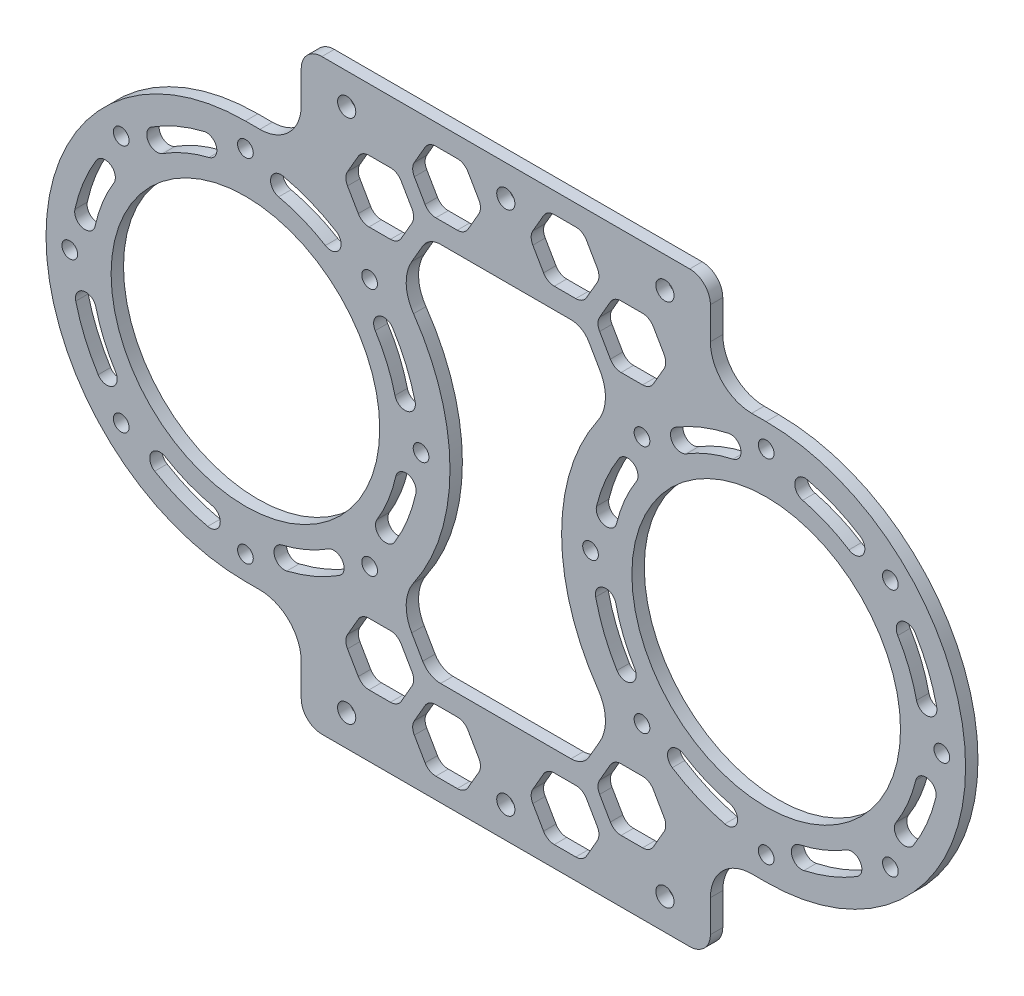
from build123d import *

# Parameters (mm, degrees)
SKETCH_1_R          = 32.5
SKETCH_1_R_2        = 1.9
EXTRUDE_1_DEPTH     = 3
SKETCH_2_W          = 99
SKETCH_2_H          = 27.75
EXTRUDE_2_DEPTH     = 3
SKETCH_3_R          = 2.2
CUT_EXTRUDE_1_DEPTH = 55
CUT_EXTRUDE_2_DEPTH = 43
SKETCH_7_W          = 99
SKETCH_7_H          = 5
CUT_EXTRUDE_3_DEPTH = 10
FILLET_1_R          = 5
FILLET_2_R          = 10
CUT_EXTRUDE_4_DEPTH = 10
EXTRUDE_3_DEPTH     = 3
CUT_EXTRUDE_5_DEPTH = 43
FILLET_3_R          = 5
FILLET_4_R          = 10


with BuildPart() as part:
    # 草图1 → 凸台-拉伸1 (new body)
    with BuildSketch(Plane.XY):
        with BuildLine():
            Line((0, 48.25), (126, 48.25))
            ThreePointArc((126, 48.25), (174.25, 0), (126, -48.25))
            Line((126, -48.25), (0, -48.25))
            ThreePointArc((0, -48.25), (-48.25, 0), (0, 48.25))
        make_face()
        with Locations((126, 0)):
            Circle(SKETCH_1_R, mode=Mode.SUBTRACT)
        Circle(SKETCH_1_R, mode=Mode.SUBTRACT)
        with Locations((0, 42.5)):
            Circle(SKETCH_1_R_2, mode=Mode.SUBTRACT)
        with Locations((30.0520382, 30.0520382)):
            Circle(SKETCH_1_R_2, mode=Mode.SUBTRACT)
        with Locations((42.5, 0)):
            Circle(SKETCH_1_R_2, mode=Mode.SUBTRACT)
        with Locations((30.0520382, -30.0520382)):
            Circle(SKETCH_1_R_2, mode=Mode.SUBTRACT)
        with Locations((0, -42.5)):
            Circle(SKETCH_1_R_2, mode=Mode.SUBTRACT)
        with Locations((-30.0520382, -30.0520382)):
            Circle(SKETCH_1_R_2, mode=Mode.SUBTRACT)
        with Locations((-42.5, 0)):
            Circle(SKETCH_1_R_2, mode=Mode.SUBTRACT)
        with Locations((-30.0520382, 30.0520382)):
            Circle(SKETCH_1_R_2, mode=Mode.SUBTRACT)
        with Locations((156.0520382, 30.0520382)):
            Circle(SKETCH_1_R_2, mode=Mode.SUBTRACT)
        with Locations((83.5, 0)):
            Circle(SKETCH_1_R_2, mode=Mode.SUBTRACT)
        with Locations((95.9479618, -30.0520382)):
            Circle(SKETCH_1_R_2, mode=Mode.SUBTRACT)
        with Locations((126, -42.5)):
            Circle(SKETCH_1_R_2, mode=Mode.SUBTRACT)
        with Locations((156.0520382, -30.0520382)):
            Circle(SKETCH_1_R_2, mode=Mode.SUBTRACT)
        with Locations((168.5, 0)):
            Circle(SKETCH_1_R_2, mode=Mode.SUBTRACT)
        with Locations((126, 42.5)):
            Circle(SKETCH_1_R_2, mode=Mode.SUBTRACT)
        with Locations((95.9479618, 30.0520382)):
            Circle(SKETCH_1_R_2, mode=Mode.SUBTRACT)
    extrude(amount=EXTRUDE_1_DEPTH)

    # 草图2 → 凸台-拉伸2 (add)
    with BuildSketch(Plane.XY.offset(3)):
        with Locations((63, 62.125)):
            Rectangle(SKETCH_2_W, SKETCH_2_H)
        with Locations((63, -62.125)):
            Rectangle(SKETCH_2_W, SKETCH_2_H)
    extrude(amount=-EXTRUDE_2_DEPTH)

    # 草图3 → 切除-拉伸1 (cut)
    with BuildSketch(Plane.XY.offset(3)):
        with Locations((63, 63.5)):
            Circle(SKETCH_3_R)
        with Locations((24.5, 63.5)):
            Circle(SKETCH_3_R)
        with Locations((101.5, 63.5)):
            Circle(SKETCH_3_R)
        with Locations((101.5, -63.5)):
            Circle(SKETCH_3_R)
        with Locations((63, -63.5)):
            Circle(SKETCH_3_R)
        with Locations((24.5, -63.5)):
            Circle(SKETCH_3_R)
    extrude(amount=-CUT_EXTRUDE_1_DEPTH, mode=Mode.SUBTRACT)

    # 草图5 → 切除-拉伸2 (cut)
    with BuildSketch(Plane.XY.offset(3)):
        with BuildLine():
            ThreePointArc((35.098076211, 41), (36.598076211, 41.401923789), (37.696152423, 42.5))
            Line((37.696152423, 42.5), (40.294228634, 47))
            ThreePointArc((40.294228634, 47), (40.696152423, 48.5), (40.294228634, 50))
            Line((40.294228634, 50), (37.696152423, 54.5))
            ThreePointArc((37.696152423, 54.5), (36.598076211, 55.598076211), (35.098076211, 56))
            Line((35.098076211, 56), (29.901923789, 56))
            ThreePointArc((29.901923789, 56), (28.401923789, 55.598076211), (27.303847577, 54.5))
            Line((27.303847577, 54.5), (24.705771366, 50))
            ThreePointArc((24.705771366, 50), (24.303847577, 48.5), (24.705771366, 47))
            Line((24.705771366, 47), (27.303847577, 42.5))
            ThreePointArc((27.303847577, 42.5), (28.401923789, 41.401923789), (29.901923789, 41))
            Line((29.901923789, 41), (35.098076211, 41))
        make_face()
        with BuildLine():
            Line((46.645081595, 13), (51.841234018, 13))
            ThreePointArc((51.841234018, 13), (53.341234018, 13.401923789), (54.439310229, 14.5))
            Line((54.439310229, 14.5), (57.037386441, 19))
            ThreePointArc((57.037386441, 19), (57.439310229, 20.5), (57.037386441, 22))
            Line((57.037386441, 22), (54.439310229, 26.5))
            ThreePointArc((54.439310229, 26.5), (53.341234018, 27.598076211), (51.841234018, 28))
            Line((51.841234018, 28), (46.645081595, 28))
            ThreePointArc((46.645081595, 28), (45.145081595, 27.598076211), (44.047005384, 26.5))
            Line((44.047005384, 26.5), (41.448929172, 22))
            ThreePointArc((41.448929172, 22), (41.047005384, 20.5), (41.448929172, 19))
            Line((41.448929172, 19), (44.047005384, 14.5))
            ThreePointArc((44.047005384, 14.5), (45.145081595, 13.401923789), (46.645081595, 13))
        make_face()
        with BuildLine():
            Line((41.448929172, -22), (44.047005384, -26.5))
            ThreePointArc((44.047005384, -26.5), (45.145081595, -27.598076211), (46.645081595, -28))
            Line((46.645081595, -28), (51.841234018, -28))
            ThreePointArc((51.841234018, -28), (53.341234018, -27.598076211), (54.439310229, -26.5))
            Line((54.439310229, -26.5), (57.037386441, -22))
            ThreePointArc((57.037386441, -22), (57.439310229, -20.5), (57.037386441, -19))
            Line((57.037386441, -19), (54.439310229, -14.5))
            ThreePointArc((54.439310229, -14.5), (53.341234018, -13.401923789), (51.841234018, -13))
            Line((51.841234018, -13), (46.645081595, -13))
            ThreePointArc((46.645081595, -13), (45.145081595, -13.401923789), (44.047005384, -14.5))
            Line((44.047005384, -14.5), (41.448929172, -19))
            ThreePointArc((41.448929172, -19), (41.047005384, -20.5), (41.448929172, -22))
        make_face()
        with BuildLine():
            Line((35.098076211, -41), (29.901923789, -41))
            ThreePointArc((29.901923789, -41), (28.401923789, -41.401923789), (27.303847577, -42.5))
            Line((27.303847577, -42.5), (24.705771366, -47))
            ThreePointArc((24.705771366, -47), (24.303847577, -48.5), (24.705771366, -50))
            Line((24.705771366, -50), (27.303847577, -54.5))
            ThreePointArc((27.303847577, -54.5), (28.401923789, -55.598076211), (29.901923789, -56))
            Line((29.901923789, -56), (35.098076211, -56))
            ThreePointArc((35.098076211, -56), (36.598076211, -55.598076211), (37.696152423, -54.5))
            Line((37.696152423, -54.5), (40.294228634, -50))
            ThreePointArc((40.294228634, -50), (40.696152423, -48.5), (40.294228634, -47))
            Line((40.294228634, -47), (37.696152423, -42.5))
            ThreePointArc((37.696152423, -42.5), (36.598076211, -41.401923789), (35.098076211, -41))
        make_face()
        with BuildLine():
            Line((90.901923789, 41), (96.098076211, 41))
            ThreePointArc((96.098076211, 41), (97.598076211, 41.401923789), (98.696152423, 42.5))
            Line((98.696152423, 42.5), (101.294228634, 47))
            ThreePointArc((101.294228634, 47), (101.696152423, 48.5), (101.294228634, 50))
            Line((101.294228634, 50), (98.696152423, 54.5))
            ThreePointArc((98.696152423, 54.5), (97.598076211, 55.598076211), (96.098076211, 56))
            Line((96.098076211, 56), (90.901923789, 56))
            ThreePointArc((90.901923789, 56), (89.401923789, 55.598076211), (88.303847577, 54.5))
            Line((88.303847577, 54.5), (85.705771366, 50))
            ThreePointArc((85.705771366, 50), (85.303847577, 48.5), (85.705771366, 47))
            Line((85.705771366, 47), (88.303847577, 42.5))
            ThreePointArc((88.303847577, 42.5), (89.401923789, 41.401923789), (90.901923789, 41))
        make_face()
        with BuildLine():
            Line((96.098076211, -41), (90.901923789, -41))
            ThreePointArc((90.901923789, -41), (89.401923789, -41.401923789), (88.303847577, -42.5))
            Line((88.303847577, -42.5), (85.705771366, -47))
            ThreePointArc((85.705771366, -47), (85.303847577, -48.5), (85.705771366, -50))
            Line((85.705771366, -50), (88.303847577, -54.5))
            ThreePointArc((88.303847577, -54.5), (89.401923789, -55.598076211), (90.901923789, -56))
            Line((90.901923789, -56), (96.098076211, -56))
            ThreePointArc((96.098076211, -56), (97.598076211, -55.598076211), (98.696152423, -54.5))
            Line((98.696152423, -54.5), (101.294228634, -50))
            ThreePointArc((101.294228634, -50), (101.696152423, -48.5), (101.294228634, -47))
            Line((101.294228634, -47), (98.696152423, -42.5))
            ThreePointArc((98.696152423, -42.5), (97.598076211, -41.401923789), (96.098076211, -41))
        make_face()
        with BuildLine():
            Line((74.158765982, 13), (79.354918405, 13))
            ThreePointArc((79.354918405, 13), (80.854918405, 13.401923789), (81.952994616, 14.5))
            Line((81.952994616, 14.5), (84.551070828, 19))
            ThreePointArc((84.551070828, 19), (84.952994616, 20.5), (84.551070828, 22))
            Line((84.551070828, 22), (81.952994616, 26.5))
            ThreePointArc((81.952994616, 26.5), (80.854918405, 27.598076211), (79.354918405, 28))
            Line((79.354918405, 28), (74.158765982, 28))
            ThreePointArc((74.158765982, 28), (72.658765982, 27.598076211), (71.560689771, 26.5))
            Line((71.560689771, 26.5), (68.962613559, 22))
            ThreePointArc((68.962613559, 22), (68.560689771, 20.5), (68.962613559, 19))
            Line((68.962613559, 19), (71.560689771, 14.5))
            ThreePointArc((71.560689771, 14.5), (72.658765982, 13.401923789), (74.158765982, 13))
        make_face()
        with BuildLine():
            Line((79.354918405, -13), (74.158765982, -13))
            ThreePointArc((74.158765982, -13), (72.658765982, -13.401923789), (71.560689771, -14.5))
            Line((71.560689771, -14.5), (68.962613559, -19))
            ThreePointArc((68.962613559, -19), (68.560689771, -20.5), (68.962613559, -22))
            Line((68.962613559, -22), (71.560689771, -26.5))
            ThreePointArc((71.560689771, -26.5), (72.658765982, -27.598076211), (74.158765982, -28))
            Line((74.158765982, -28), (79.354918405, -28))
            ThreePointArc((79.354918405, -28), (80.854918405, -27.598076211), (81.952994616, -26.5))
            Line((81.952994616, -26.5), (84.551070828, -22))
            ThreePointArc((84.551070828, -22), (84.952994616, -20.5), (84.551070828, -19))
            Line((84.551070828, -19), (81.952994616, -14.5))
            ThreePointArc((81.952994616, -14.5), (80.854918405, -13.401923789), (79.354918405, -13))
        make_face()
        with BuildLine():
            ThreePointArc((51.841234018, 32), (53.341234018, 32.401923789), (54.439310229, 33.5))
            Line((54.439310229, 33.5), (57.037386441, 38))
            ThreePointArc((57.037386441, 38), (57.439310229, 39.5), (57.037386441, 41))
            Line((57.037386441, 41), (54.439310229, 45.5))
            ThreePointArc((54.439310229, 45.5), (53.341234018, 46.598076211), (51.841234018, 47))
            Line((51.841234018, 47), (46.645081595, 47))
            ThreePointArc((46.645081595, 47), (45.145081595, 46.598076211), (44.047005384, 45.5))
            Line((44.047005384, 45.5), (41.448929172, 41))
            ThreePointArc((41.448929172, 41), (41.047005384, 39.5), (41.448929172, 38))
            Line((41.448929172, 38), (44.047005384, 33.5))
            ThreePointArc((44.047005384, 33.5), (45.145081595, 32.401923789), (46.645081595, 32))
            Line((46.645081595, 32), (51.841234018, 32))
        make_face()
        with BuildLine():
            ThreePointArc((51.263883749, 51), (52.763883749, 51.401923789), (53.86195996, 52.5))
            Line((53.86195996, 52.5), (56.460036171, 57))
            ThreePointArc((56.460036171, 57), (56.86195996, 58.5), (56.460036171, 60))
            Line((56.460036171, 60), (53.86195996, 64.5))
            ThreePointArc((53.86195996, 64.5), (52.763883749, 65.598076211), (51.263883749, 66))
            Line((51.263883749, 66), (46.067731326, 66))
            ThreePointArc((46.067731326, 66), (44.567731326, 65.598076211), (43.469655115, 64.5))
            Line((43.469655115, 64.5), (40.871578903, 60))
            ThreePointArc((40.871578903, 60), (40.469655115, 58.5), (40.871578903, 57))
            Line((40.871578903, 57), (43.469655115, 52.5))
            ThreePointArc((43.469655115, 52.5), (44.567731326, 51.401923789), (46.067731326, 51))
            Line((46.067731326, 51), (51.263883749, 51))
        make_face()
        with BuildLine():
            Line((51.263883749, -51), (46.067731326, -51))
            ThreePointArc((46.067731326, -51), (44.567731326, -51.401923789), (43.469655115, -52.5))
            Line((43.469655115, -52.5), (40.871578903, -57))
            ThreePointArc((40.871578903, -57), (40.469655115, -58.5), (40.871578903, -60))
            Line((40.871578903, -60), (43.469655115, -64.5))
            ThreePointArc((43.469655115, -64.5), (44.567731326, -65.598076211), (46.067731326, -66))
            Line((46.067731326, -66), (51.263883749, -66))
            ThreePointArc((51.263883749, -66), (52.763883749, -65.598076211), (53.86195996, -64.5))
            Line((53.86195996, -64.5), (56.460036171, -60))
            ThreePointArc((56.460036171, -60), (56.86195996, -58.5), (56.460036171, -57))
            Line((56.460036171, -57), (53.86195996, -52.5))
            ThreePointArc((53.86195996, -52.5), (52.763883749, -51.401923789), (51.263883749, -51))
        make_face()
        with BuildLine():
            Line((51.841234018, -32), (46.645081595, -32))
            ThreePointArc((46.645081595, -32), (45.145081595, -32.401923789), (44.047005384, -33.5))
            Line((44.047005384, -33.5), (41.448929172, -38))
            ThreePointArc((41.448929172, -38), (41.047005384, -39.5), (41.448929172, -41))
            Line((41.448929172, -41), (44.047005384, -45.5))
            ThreePointArc((44.047005384, -45.5), (45.145081595, -46.598076211), (46.645081595, -47))
            Line((46.645081595, -47), (51.841234018, -47))
            ThreePointArc((51.841234018, -47), (53.341234018, -46.598076211), (54.439310229, -45.5))
            Line((54.439310229, -45.5), (57.037386441, -41))
            ThreePointArc((57.037386441, -41), (57.439310229, -39.5), (57.037386441, -38))
            Line((57.037386441, -38), (54.439310229, -33.5))
            ThreePointArc((54.439310229, -33.5), (53.341234018, -32.401923789), (51.841234018, -32))
        make_face()
        with BuildLine():
            ThreePointArc((84.551070828, -41), (84.952994616, -39.5), (84.551070828, -38))
            Line((84.551070828, -38), (81.952994616, -33.5))
            ThreePointArc((81.952994616, -33.5), (80.854918405, -32.401923789), (79.354918405, -32))
            Line((79.354918405, -32), (74.158765982, -32))
            ThreePointArc((74.158765982, -32), (72.658765982, -32.401923789), (71.560689771, -33.5))
            Line((71.560689771, -33.5), (68.962613559, -38))
            ThreePointArc((68.962613559, -38), (68.560689771, -39.5), (68.962613559, -41))
            Line((68.962613559, -41), (71.560689771, -45.5))
            ThreePointArc((71.560689771, -45.5), (72.658765982, -46.598076211), (74.158765982, -47))
            Line((74.158765982, -47), (79.354918405, -47))
            ThreePointArc((79.354918405, -47), (80.854918405, -46.598076211), (81.952994616, -45.5))
            Line((81.952994616, -45.5), (84.551070828, -41))
        make_face()
        with BuildLine():
            ThreePointArc((85.128421097, -60), (85.530344885, -58.5), (85.128421097, -57))
            Line((85.128421097, -57), (82.530344885, -52.5))
            ThreePointArc((82.530344885, -52.5), (81.432268674, -51.401923789), (79.932268674, -51))
            Line((79.932268674, -51), (74.736116251, -51))
            ThreePointArc((74.736116251, -51), (73.236116251, -51.401923789), (72.13804004, -52.5))
            Line((72.13804004, -52.5), (69.539963829, -57))
            ThreePointArc((69.539963829, -57), (69.13804004, -58.5), (69.539963829, -60))
            Line((69.539963829, -60), (72.13804004, -64.5))
            ThreePointArc((72.13804004, -64.5), (73.236116251, -65.598076211), (74.736116251, -66))
            Line((74.736116251, -66), (79.932268674, -66))
            ThreePointArc((79.932268674, -66), (81.432268674, -65.598076211), (82.530344885, -64.5))
            Line((82.530344885, -64.5), (85.128421097, -60))
        make_face()
        with BuildLine():
            Line((74.158765982, 32), (79.354918405, 32))
            ThreePointArc((79.354918405, 32), (80.854918405, 32.401923789), (81.952994616, 33.5))
            Line((81.952994616, 33.5), (84.551070828, 38))
            ThreePointArc((84.551070828, 38), (84.952994616, 39.5), (84.551070828, 41))
            Line((84.551070828, 41), (81.952994616, 45.5))
            ThreePointArc((81.952994616, 45.5), (80.854918405, 46.598076211), (79.354918405, 47))
            Line((79.354918405, 47), (74.158765982, 47))
            ThreePointArc((74.158765982, 47), (72.658765982, 46.598076211), (71.560689771, 45.5))
            Line((71.560689771, 45.5), (68.962613559, 41))
            ThreePointArc((68.962613559, 41), (68.560689771, 39.5), (68.962613559, 38))
            Line((68.962613559, 38), (71.560689771, 33.5))
            ThreePointArc((71.560689771, 33.5), (72.658765982, 32.401923789), (74.158765982, 32))
        make_face()
        with BuildLine():
            Line((74.736116251, 51), (79.932268674, 51))
            ThreePointArc((79.932268674, 51), (81.432268674, 51.401923789), (82.530344885, 52.5))
            Line((82.530344885, 52.5), (85.128421097, 57))
            ThreePointArc((85.128421097, 57), (85.530344885, 58.5), (85.128421097, 60))
            Line((85.128421097, 60), (82.530344885, 64.5))
            ThreePointArc((82.530344885, 64.5), (81.432268674, 65.598076211), (79.932268674, 66))
            Line((79.932268674, 66), (74.736116251, 66))
            ThreePointArc((74.736116251, 66), (73.236116251, 65.598076211), (72.13804004, 64.5))
            Line((72.13804004, 64.5), (69.539963829, 60))
            ThreePointArc((69.539963829, 60), (69.13804004, 58.5), (69.539963829, 57))
            Line((69.539963829, 57), (72.13804004, 52.5))
            ThreePointArc((72.13804004, 52.5), (73.236116251, 51.401923789), (74.736116251, 51))
        make_face()
        Polygon((58.669872981, -7.5), (67.330127019, -7.5), (71.660254038, 0), (67.330127019, 7.5), (58.669872981, 7.5), (54.339745962, 0), align=None)
    extrude(amount=-CUT_EXTRUDE_2_DEPTH, mode=Mode.SUBTRACT)

    # 草图7 → 切除-拉伸3 (cut)
    with BuildSketch(Plane.XY.offset(3)):
        with Locations((63, 73.5)):
            Rectangle(SKETCH_7_W, SKETCH_7_H)
        with Locations((63, -73.5)):
            Rectangle(SKETCH_7_W, SKETCH_7_H)
    extrude(amount=-CUT_EXTRUDE_3_DEPTH, mode=Mode.SUBTRACT)

    # 圆角1
    fillet_1_edges = [part.edges().sort_by_distance(p)[0] for p in [
        (13.5, -71, 1.5),
        (112.5, -71, 1.5),
        (13.5, 71, 1.5),
        (112.5, 71, 1.5),
    ]]
    fillet(fillet_1_edges, radius=FILLET_1_R)

    # 圆角2
    fillet_2_edges = [part.edges().sort_by_distance(p)[0] for p in [
        (112.5, 48.25, 1.5),
        (13.5, -48.25, 1.5),
        (112.5, -48.25, 1.5),
        (13.5, 48.25, 1.5),
    ]]
    fillet(fillet_2_edges, radius=FILLET_2_R)

    # 草图8 → 切除-拉伸4 (cut)
    with BuildSketch(Plane.XY.offset(3)):
        with BuildLine():
            ThreePointArc((31.406606344, 20.029667444), (34.259155408, 14.624389585), (36.189426221, 8.825413859))
            ThreePointArc((36.189426221, 8.825413859), (39.210557746, 6.988908141), (41.047066136, 10.010038042))
            ThreePointArc((41.047066136, 10.010038042), (38.857696388, 16.587402793), (35.622251669, 22.718223655))
            ThreePointArc((35.622251669, 22.718223655), (32.170152581, 23.481765578), (31.406606344, 20.029667444))
        make_face()
        with BuildLine():
            ThreePointArc((36.102820185, -21.946500284), (39.205600555, -15.747488216), (41.252941689, -9.124543936))
            ThreePointArc((41.252941689, -9.124543936), (39.351856232, -6.14361903), (36.370937289, -8.044713837))
            ThreePointArc((36.370937289, -8.044713837), (34.565886368, -13.883875525), (31.830300972, -19.349274923))
            ThreePointArc((31.830300972, -19.349274923), (32.667950101, -22.784143585), (36.102820185, -21.946500284))
        make_face()
        with BuildLine():
            ThreePointArc((8.044707883, 36.370938606), (13.883872674, 34.565887513), (19.349274885, 31.830300995))
            ThreePointArc((19.349274885, 31.830300995), (22.784147379, 32.667956342), (21.946487763, 36.102827796))
            ThreePointArc((21.946487763, 36.102827796), (15.747479973, 39.205603866), (9.124540896, 41.252942361))
            ThreePointArc((9.124540896, 41.252942361), (6.143619352, 39.351857689), (8.044707883, 36.370938606))
        make_face()
        with BuildLine():
            ThreePointArc((10.010031287, -41.047067784), (16.58739934, -38.857697862), (22.718223185, -35.622251968))
            ThreePointArc((22.718223185, -35.622251968), (23.481764351, -32.170150657), (20.029663126, -31.406609098))
            ThreePointArc((20.029663126, -31.406609098), (14.624393448, -34.259153759), (8.825426996, -36.189423018))
            ThreePointArc((8.825426996, -36.189423018), (6.988905715, -39.2105478), (10.010031287, -41.047067784))
        make_face()
        with BuildLine():
            ThreePointArc((-20.029669586, 31.406604978), (-14.624392694, 34.259154081), (-8.825417958, 36.189425222))
            ThreePointArc((-8.825417958, 36.189425222), (-6.988907619, 39.210555607), (-10.010037862, 41.04706618))
            ThreePointArc((-10.010037862, 41.04706618), (-16.587398606, 38.857698175), (-22.718216133, 35.622256466))
            ThreePointArc((-22.718216133, 35.622256466), (-23.48176866, 32.170157413), (-20.029669586, 31.406604978))
        make_face()
        with BuildLine():
            ThreePointArc((-21.946495858, -36.102822875), (-15.747478815, -39.205604331), (-9.12452921, -41.252944946))
            ThreePointArc((-9.12452921, -41.252944946), (-6.143617148, -39.351847725), (-8.044716126, -36.370936783))
            ThreePointArc((-8.044716126, -36.370936783), (-13.883876613, -34.565885931), (-19.349274923, -31.830300971))
            ThreePointArc((-19.349274923, -31.830300971), (-22.78414493, -32.667952315), (-21.946495858, -36.102822875))
        make_face()
        with BuildLine():
            ThreePointArc((-36.370937454, 8.044713089), (-34.565886511, 13.88387517), (-31.830300971, 19.349274924))
            ThreePointArc((-31.830300971, 19.349274924), (-32.66795378, 22.784145821), (-36.102824656, 21.946492928))
            ThreePointArc((-36.102824656, 21.946492928), (-39.205603944, 15.74747978), (-41.252943756, 9.124534588))
            ThreePointArc((-41.252943756, 9.124534588), (-39.351851932, 6.143618079), (-36.370937454, 8.044713089))
        make_face()
        with BuildLine():
            ThreePointArc((-41.047066163, -10.010037932), (-38.857698184, -16.587398585), (-35.622256529, -22.718216035))
            ThreePointArc((-35.622256529, -22.718216035), (-32.170154403, -23.48176674), (-31.40660888, -20.029663469))
            ThreePointArc((-31.40660888, -20.029663469), (-34.259153887, -14.624393148), (-36.189423269, -8.825425966))
            ThreePointArc((-36.189423269, -8.825425966), (-39.210551638, -6.988906651), (-41.047066163, -10.010037932))
        make_face()
        with BuildLine():
            ThreePointArc((167.047066155, -10.010037965), (165.210551654, -6.988906655), (162.189423269, -8.825425966))
            ThreePointArc((162.189423269, -8.825425966), (160.259152417, -14.624396591), (157.406604854, -20.029669781))
            ThreePointArc((157.406604854, -20.029669781), (158.170157439, -23.481768677), (161.622256376, -22.718216275))
            ThreePointArc((161.622256376, -22.718216275), (164.857698122, -16.587398732), (167.047066155, -10.010037965))
        make_face()
        with BuildLine():
            ThreePointArc((145.349266966, -31.830305809), (139.883872295, -34.565887665), (134.044716132, -36.370936781))
            ThreePointArc((134.044716132, -36.370936781), (132.143617147, -39.35184772), (135.124529207, -41.252944946))
            ThreePointArc((135.124529207, -41.252944946), (141.747477283, -39.205604947), (147.946493039, -36.102824589))
            ThreePointArc((147.946493039, -36.102824589), (148.784143369, -32.667949746), (145.349266966, -31.830305809))
        make_face()
        with BuildLine():
            ThreePointArc((157.830303801, 19.349270269), (160.565889488, 13.883867757), (162.370939728, 8.044702809))
            ThreePointArc((162.370939728, 8.044702809), (165.351857037, 6.143619208), (167.252943772, 9.124534517))
            ThreePointArc((167.252943772, 9.124534517), (165.205603934, 15.747479805), (162.10282459, 21.946493037))
            ThreePointArc((162.10282459, 21.946493037), (158.667951398, 22.784144373), (157.830303801, 19.349270269))
        make_face()
        with BuildLine():
            ThreePointArc((117.174573004, -36.189423017), (111.375602925, -34.259152211), (105.970330225, -31.406604858))
            ThreePointArc((105.970330225, -31.406604858), (102.518231255, -32.170157547), (103.281783947, -35.622256517))
            ThreePointArc((103.281783947, -35.622256517), (109.412604552, -38.857699524), (115.989968718, -41.047067785))
            ThreePointArc((115.989968718, -41.047067785), (119.011094286, -39.210547798), (117.174573004, -36.189423017))
        make_face()
        with BuildLine():
            ThreePointArc((134.825418167, 36.189425171), (140.624393152, 34.259153885), (146.029670245, 31.406604558))
            ThreePointArc((146.029670245, 31.406604558), (149.481768875, 32.170157751), (148.718216116, 35.622256477))
            ThreePointArc((148.718216116, 35.622256477), (142.587398767, 38.857698107), (136.010038222, 41.047066092))
            ThreePointArc((136.010038222, 41.047066092), (132.988907637, 39.210555682), (134.825418167, 36.189425171))
        make_face()
        with BuildLine():
            ThreePointArc((94.169702884, -19.349281266), (91.434112766, -13.88387337), (89.629060105, -8.044702055))
            ThreePointArc((89.629060105, -8.044702055), (86.648137876, -6.143620333), (84.747058312, -9.124543939))
            ThreePointArc((84.747058312, -9.124543939), (86.794397864, -15.74748428), (89.897175408, -21.946493033))
            ThreePointArc((89.897175408, -21.946493033), (93.332043102, -22.784147717), (94.169702884, -19.349281266))
        make_face()
        with BuildLine():
            ThreePointArc((106.650725067, 31.830300965), (112.116127295, 34.565887501), (117.955292109, 36.370938604))
            ThreePointArc((117.955292109, 36.370938604), (119.856382061, 39.351851303), (116.875471868, 41.252945184))
            ThreePointArc((116.875471868, 41.252945184), (110.252523231, 39.205605153), (104.053506967, 36.102824592))
            ThreePointArc((104.053506967, 36.102824593), (103.215854208, 32.667953732), (106.650725067, 31.830300965))
        make_face()
        with BuildLine():
            ThreePointArc((84.952931914, 10.010030047), (86.789446253, 6.988907165), (89.81057378, 8.825413864))
            ThreePointArc((89.81057378, 8.825413864), (91.740845136, 14.62439086), (94.593395144, 20.029669778))
            ThreePointArc((94.593395144, 20.029669778), (93.829842453, 23.481768745), (90.377743485, 22.718216057))
            ThreePointArc((90.377743485, 22.718216057), (87.142300228, 16.587394865), (84.952931914, 10.010030047))
        make_face()
    extrude(amount=-CUT_EXTRUDE_4_DEPTH, mode=Mode.SUBTRACT)

    # 草图10 → 凸台-拉伸3 (add)
    with BuildSketch(Plane.XY.offset(3)):
        with BuildLine():
            Line((54.439310229, -33.5), (57.037386441, -38))
            ThreePointArc((57.037386441, -38), (57.439310229, -39.5), (57.037386441, -41))
            Line((57.037386441, -41), (54.439310229, -45.5))
            ThreePointArc((54.439310229, -45.5), (53.341234018, -46.598076211), (51.841234018, -47))
            Line((51.841234018, -47), (46.645081595, -47))
            ThreePointArc((46.645081595, -47), (45.145081595, -46.598076211), (44.047005384, -45.5))
            Line((44.047005384, -45.5), (41.448929172, -41))
            ThreePointArc((41.448929172, -41), (41.047005384, -39.5), (41.448929172, -38))
            Line((41.448929172, -38), (44.047005384, -33.5))
            ThreePointArc((44.047005384, -33.5), (45.145081595, -32.401923789), (46.645081595, -32))
            Line((46.645081595, -32), (51.841234018, -32))
            ThreePointArc((51.841234018, -32), (53.341234018, -32.401923789), (54.439310229, -33.5))
        make_face()
        with BuildLine():
            Line((71.560689771, -33.5), (68.962613559, -38))
            ThreePointArc((68.962613559, -38), (68.560689771, -39.5), (68.962613559, -41))
            Line((68.962613559, -41), (71.560689771, -45.5))
            ThreePointArc((71.560689771, -45.5), (72.658765982, -46.598076211), (74.158765982, -47))
            Line((74.158765982, -47), (79.354918405, -47))
            ThreePointArc((79.354918405, -47), (80.854918405, -46.598076211), (81.952994616, -45.5))
            Line((81.952994616, -45.5), (84.551070828, -41))
            ThreePointArc((84.551070828, -41), (84.952994616, -39.5), (84.551070828, -38))
            Line((84.551070828, -38), (81.952994616, -33.5))
            ThreePointArc((81.952994616, -33.5), (80.854918405, -32.401923789), (79.354918405, -32))
            Line((79.354918405, -32), (74.158765982, -32))
            ThreePointArc((74.158765982, -32), (72.658765982, -32.401923789), (71.560689771, -33.5))
        make_face()
        with BuildLine():
            Line((84.551070828, -19), (81.952994616, -14.5))
            ThreePointArc((81.952994616, -14.5), (80.854918405, -13.401923789), (79.354918405, -13))
            Line((79.354918405, -13), (74.158765982, -13))
            ThreePointArc((74.158765982, -13), (72.658765982, -13.401923789), (71.560689771, -14.5))
            Line((71.560689771, -14.5), (68.962613559, -19))
            ThreePointArc((68.962613559, -19), (68.560689771, -20.5), (68.962613559, -22))
            Line((68.962613559, -22), (71.560689771, -26.5))
            ThreePointArc((71.560689771, -26.5), (72.658765982, -27.598076211), (74.158765982, -28))
            Line((74.158765982, -28), (79.354918405, -28))
            ThreePointArc((79.354918405, -28), (80.854918405, -27.598076211), (81.952994616, -26.5))
            Line((81.952994616, -26.5), (84.551070828, -22))
            ThreePointArc((84.551070828, -22), (84.952994616, -20.5), (84.551070828, -19))
        make_face()
        with BuildLine():
            Line((46.645081595, -13), (51.841234018, -13))
            ThreePointArc((51.841234018, -13), (53.341234018, -13.401923789), (54.439310229, -14.5))
            Line((54.439310229, -14.5), (57.037386441, -19))
            ThreePointArc((57.037386441, -19), (57.439310229, -20.5), (57.037386441, -22))
            Line((57.037386441, -22), (54.439310229, -26.5))
            ThreePointArc((54.439310229, -26.5), (53.341234018, -27.598076211), (51.841234018, -28))
            Line((51.841234018, -28), (46.645081595, -28))
            ThreePointArc((46.645081595, -28), (45.145081595, -27.598076211), (44.047005384, -26.5))
            Line((44.047005384, -26.5), (41.448929172, -22))
            ThreePointArc((41.448929172, -22), (41.047005384, -20.5), (41.448929172, -19))
            Line((41.448929172, -19), (44.047005384, -14.5))
            ThreePointArc((44.047005384, -14.5), (45.145081595, -13.401923789), (46.645081595, -13))
        make_face()
        with BuildLine():
            Line((81.952994616, 26.5), (84.551070828, 22))
            ThreePointArc((84.551070828, 22), (84.952994616, 20.5), (84.551070828, 19))
            Line((84.551070828, 19), (81.952994616, 14.5))
            ThreePointArc((81.952994616, 14.5), (80.854918405, 13.401923789), (79.354918405, 13))
            Line((79.354918405, 13), (74.158765982, 13))
            ThreePointArc((74.158765982, 13), (72.658765982, 13.401923789), (71.560689771, 14.5))
            Line((71.560689771, 14.5), (68.962613559, 19))
            ThreePointArc((68.962613559, 19), (68.560689771, 20.5), (68.962613559, 22))
            Line((68.962613559, 22), (71.560689771, 26.5))
            ThreePointArc((71.560689771, 26.5), (72.658765982, 27.598076211), (74.158765982, 28))
            Line((74.158765982, 28), (79.354918405, 28))
            ThreePointArc((79.354918405, 28), (80.854918405, 27.598076211), (81.952994616, 26.5))
        make_face()
        with BuildLine():
            Line((54.439310229, 14.5), (57.037386441, 19))
            ThreePointArc((57.037386441, 19), (57.439310229, 20.5), (57.037386441, 22))
            Line((57.037386441, 22), (54.439310229, 26.5))
            ThreePointArc((54.439310229, 26.5), (53.341234018, 27.598076211), (51.841234018, 28))
            Line((51.841234018, 28), (46.645081595, 28))
            ThreePointArc((46.645081595, 28), (45.145081595, 27.598076211), (44.047005384, 26.5))
            Line((44.047005384, 26.5), (41.448929172, 22))
            ThreePointArc((41.448929172, 22), (41.047005384, 20.5), (41.448929172, 19))
            Line((41.448929172, 19), (44.047005384, 14.5))
            ThreePointArc((44.047005384, 14.5), (45.145081595, 13.401923789), (46.645081595, 13))
            Line((46.645081595, 13), (51.841234018, 13))
            ThreePointArc((51.841234018, 13), (53.341234018, 13.401923789), (54.439310229, 14.5))
        make_face()
        Polygon((71.660254038, 0), (67.330127019, 7.5), (58.669872981, 7.5), (54.339745962, 0), (58.669872981, -7.5), (67.330127019, -7.5), align=None)
        with BuildLine():
            Line((81.952994616, 45.5), (84.551070828, 41))
            ThreePointArc((84.551070828, 41), (84.952994616, 39.5), (84.551070828, 38))
            Line((84.551070828, 38), (81.952994616, 33.5))
            ThreePointArc((81.952994616, 33.5), (80.854918405, 32.401923789), (79.354918405, 32))
            Line((79.354918405, 32), (74.158765982, 32))
            ThreePointArc((74.158765982, 32), (72.658765982, 32.401923789), (71.560689771, 33.5))
            Line((71.560689771, 33.5), (68.962613559, 38))
            ThreePointArc((68.962613559, 38), (68.560689771, 39.5), (68.962613559, 41))
            Line((68.962613559, 41), (71.560689771, 45.5))
            ThreePointArc((71.560689771, 45.5), (72.658765982, 46.598076211), (74.158765982, 47))
            Line((74.158765982, 47), (79.354918405, 47))
            ThreePointArc((79.354918405, 47), (80.854918405, 46.598076211), (81.952994616, 45.5))
        make_face()
        with BuildLine():
            Line((44.047005384, 45.5), (41.448929172, 41))
            ThreePointArc((41.448929172, 41), (41.047005384, 39.5), (41.448929172, 38))
            Line((41.448929172, 38), (44.047005384, 33.5))
            ThreePointArc((44.047005384, 33.5), (45.145081595, 32.401923789), (46.645081595, 32))
            Line((46.645081595, 32), (51.841234018, 32))
            ThreePointArc((51.841234018, 32), (53.341234018, 32.401923789), (54.439310229, 33.5))
            Line((54.439310229, 33.5), (57.037386441, 38))
            ThreePointArc((57.037386441, 38), (57.439310229, 39.5), (57.037386441, 41))
            Line((57.037386441, 41), (54.439310229, 45.5))
            ThreePointArc((54.439310229, 45.5), (53.341234018, 46.598076211), (51.841234018, 47))
            Line((51.841234018, 47), (46.645081595, 47))
            ThreePointArc((46.645081595, 47), (45.145081595, 46.598076211), (44.047005384, 45.5))
        make_face()
    extrude(amount=-EXTRUDE_3_DEPTH)

    # 草图11 → 切除-拉伸5 (cut)
    with BuildSketch(Plane.XY.offset(3)):
        with BuildLine():
            Line((81.664319482, 46), (44.335680518, 46))
            Line((44.335680518, 46), (36.855604513, 33.044128314))
            ThreePointArc((36.855604513, 33.044128314), (46.230955124, 17.690358626), (49.5, 0))
            ThreePointArc((49.5, 0), (46.230955124, -17.690358626), (36.855604513, -33.044128314))
            Line((36.855604513, -33.044128314), (44.335680518, -46))
            Line((44.335680518, -46), (81.664319482, -46))
            Line((81.664319482, -46), (89.144395487, -33.044128314))
            ThreePointArc((89.144395487, -33.044128314), (76.5, 0), (89.144395487, 33.044128314))
            Line((89.144395487, 33.044128314), (81.664319482, 46))
        make_face()
    extrude(amount=-CUT_EXTRUDE_5_DEPTH, mode=Mode.SUBTRACT)

    # 圆角3
    fillet_3_edges = [part.edges().sort_by_distance(p)[0] for p in [
        (44.335680518, -46, 1.5),
        (81.664319482, -46, 1.5),
        (44.335680518, 46, 1.5),
        (81.664319482, 46, 1.5),
    ]]
    fillet(fillet_3_edges, radius=FILLET_3_R)

    # 圆角4
    fillet_4_edges = [part.edges().sort_by_distance(p)[0] for p in [
        (36.855604513, -33.044128314, 1.5),
        (89.144395487, -33.044128314, 1.5),
        (89.144395487, 33.044128314, 1.5),
        (36.855604513, 33.044128314, 1.5),
    ]]
    fillet(fillet_4_edges, radius=FILLET_4_R)


solid = part.part
